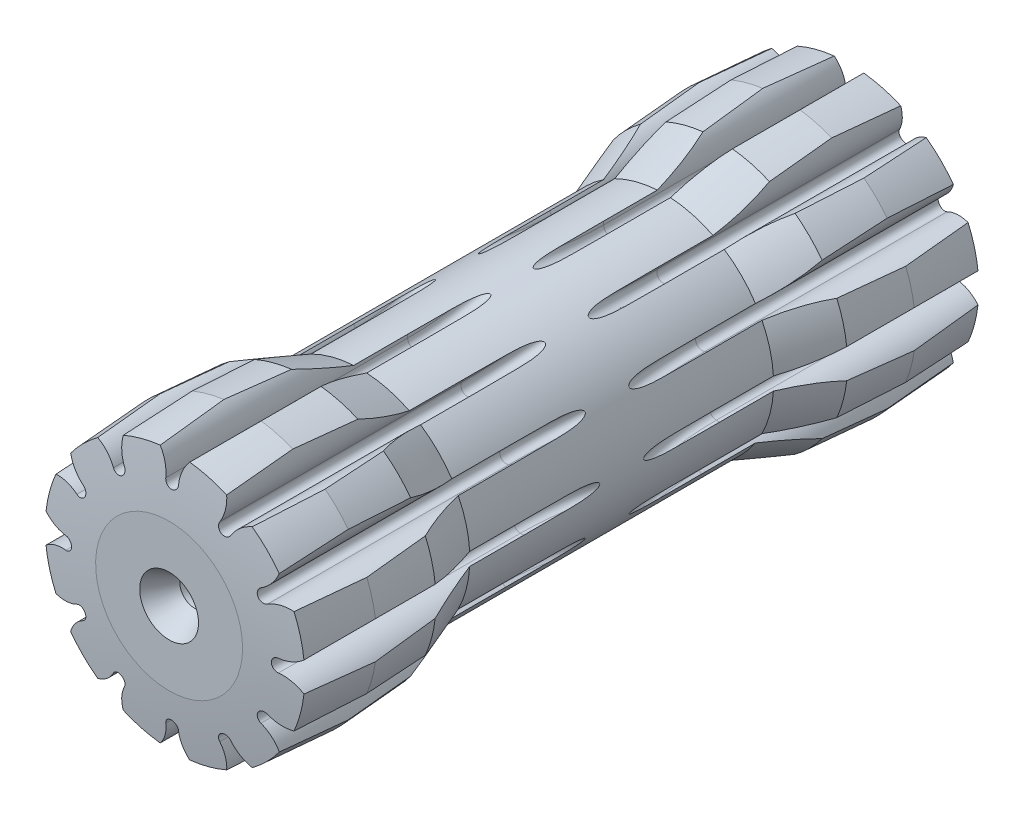
from build123d import *

# Parameters (mm, degrees)
CUT_EXTRUDE1_DEPTH = 25
CIRPATTERN1_COUNT  = 12
CUT_EXTRUDE2_START = -25
CUT_EXTRUDE2_DEPTH = 25
CIRPATTERN2_COUNT  = 12


with BuildPart() as part:
    # Sketch1 → Revolve1 (revolve)
    with BuildSketch(Plane(origin=(0, 0, 0), x_dir=(0, 0, -1), z_dir=(1, 0, 0))):
        with BuildLine():
            Line((0.600052846, 13.25), (7.5, 13.69))
            Line((7.5, 13.69), (14, 13.25))
            Line((14, 13.25), (19.5, 11.2))
            Line((19.5, 11.2), (50.5, 11.2))
            Line((50.5, 11.2), (56, 13.25))
            Line((56, 13.25), (62.5, 13.69))
            Line((62.5, 13.69), (69.399947154, 13.25))
            ThreePointArc((69.399947154, 13.25), (69.741534816, 10.379337207), (70, 7.5))
            Line((70, 7.5), (70, 0))
            Line((70, 0), (0, 0))
            Line((0, 0), (0, 7.5))
            ThreePointArc((0, 7.5), (0.258465184, 10.379337207), (0.600052846, 13.25))
        make_face()
    revolve(axis=Axis((0, 0, 0), (0, 0, -1)))

    # Sketch2 → Cut-Revolve1 (revolve, cut)
    with BuildSketch(Plane(origin=(0, 0, 0), x_dir=(0, 0, -1), z_dir=(1, 0, 0))):
        Polygon((70, 3), (67.401923789, 1.5), (64.901290929, 1.5), (64, 0), (70, 0), align=None)
    revolve(axis=Axis((0, 0, 0), (0, 0, -1)), mode=Mode.SUBTRACT)

    # Sketch3 → Cut-Revolve2 (revolve, cut)
    with BuildSketch(Plane(origin=(0, 0, 0), x_dir=(0, 0, -1), z_dir=(1, 0, 0))):
        Polygon((0, 3), (2.598076211, 1.5), (5.098709071, 1.5), (6, 0), (0, 0), align=None)
    revolve(axis=Axis((0, 0, 0), (0, 0, -1)), mode=Mode.SUBTRACT)

    # Sketch4 → Cut-Extrude1 (cut)
    with BuildSketch(Plane.XY.offset(-70)):
        with BuildLine():
            ThreePointArc((-0.65, 10.85), (0, 10.2), (0.65, 10.85))
            ThreePointArc((0.65, 10.85), (0.977583424, 12.341066306), (1.9, 13.557510833))
            ThreePointArc((1.9, 13.557510833), (0, 13.69), (-1.9, 13.557510833))
            ThreePointArc((-1.9, 13.557510833), (-0.977583424, 12.341066306), (-0.65, 10.85))
        make_face()
    cut_extrude1 = extrude(amount=CUT_EXTRUDE1_DEPTH, mode=Mode.SUBTRACT)

    # Sketch6 → Cut-Revolve3 (revolve, cut)
    with BuildSketch(Plane(origin=(0, 0, -45), x_dir=(-1, 0, 0), z_dir=(0, 0, -1))):
        with BuildLine():
            Line((-1.505655126, 13.16417497), (-1.505655126, 15.404021176))
            Line((-1.505655126, 15.404021176), (1.505655126, 15.404021176))
            Line((1.505655126, 15.404021176), (1.505655126, 13.16417497))
            ThreePointArc((1.505655126, 13.16417497), (0.870764138, 12.083648196), (0.65, 10.85))
            ThreePointArc((0.65, 10.85), (0, 10.2), (-0.65, 10.85))
            ThreePointArc((-0.65, 10.85), (-0.870764138, 12.083648196), (-1.505655126, 13.16417497))
        make_face()
    cut_revolve3 = revolve(axis=Axis((8.494917218, 40.85, -45), (-1, 0, 0)), mode=Mode.SUBTRACT)

    # CirPattern1: Cut-Extrude1, Cut-Revolve3 ×12 about axis
    cirpattern1_axis = Axis((0, 0, -50.5), (0, 0, 1))
    add([cut_extrude1.rotate(cirpattern1_axis, i * 360 / CIRPATTERN1_COUNT) for i in range(1, CIRPATTERN1_COUNT)], mode=Mode.SUBTRACT)
    add([cut_revolve3.rotate(cirpattern1_axis, i * 360 / CIRPATTERN1_COUNT) for i in range(1, CIRPATTERN1_COUNT)], mode=Mode.SUBTRACT)

    # Sketch5 → Cut-Extrude2 (cut)
    with BuildSketch(Plane.XY.offset(CUT_EXTRUDE2_START)):
        with BuildLine():
            Line((-3, 14.196125526), (-3, 15.196098841))
            Line((-3, 15.196098841), (3, 15.196098841))
            Line((3, 15.196098841), (3, 14.196125526))
            ThreePointArc((3, 14.196125526), (1.296192058, 12.894447116), (0.65, 10.85))
            ThreePointArc((0.65, 10.85), (0, 10.2), (-0.65, 10.85))
            ThreePointArc((-0.65, 10.85), (-1.296192058, 12.894447116), (-3, 14.196125526))
        make_face()
    cut_extrude2 = extrude(amount=CUT_EXTRUDE2_DEPTH, mode=Mode.SUBTRACT)

    # Sketch8 → Cut-Revolve5 (revolve, cut)
    with BuildSketch(Plane.XY.offset(-25)):
        with BuildLine():
            Line((1.505655126, 13.16417497), (1.505655126, 15.404021176))
            Line((1.505655126, 15.404021176), (-1.505655126, 15.404021176))
            Line((-1.505655126, 15.404021176), (-1.505655126, 13.16417497))
            ThreePointArc((-1.505655126, 13.16417497), (-0.870764138, 12.083648196), (-0.65, 10.85))
            ThreePointArc((-0.65, 10.85), (0, 10.2), (0.65, 10.85))
            ThreePointArc((0.65, 10.85), (0.870764138, 12.083648196), (1.505655126, 13.16417497))
        make_face()
    cut_revolve5 = revolve(axis=Axis((-13.647220523, 40.85, -25), (1, 0, 0)), mode=Mode.SUBTRACT)

    # CirPattern2: Cut-Extrude2, Cut-Revolve5 ×12 about axis
    cirpattern2_axis = Axis((0, 0, -50.5), (0, 0, 1))
    add([cut_extrude2.rotate(cirpattern2_axis, i * 360 / CIRPATTERN2_COUNT) for i in range(1, CIRPATTERN2_COUNT)], mode=Mode.SUBTRACT)
    add([cut_revolve5.rotate(cirpattern2_axis, i * 360 / CIRPATTERN2_COUNT) for i in range(1, CIRPATTERN2_COUNT)], mode=Mode.SUBTRACT)


solid = part.part
